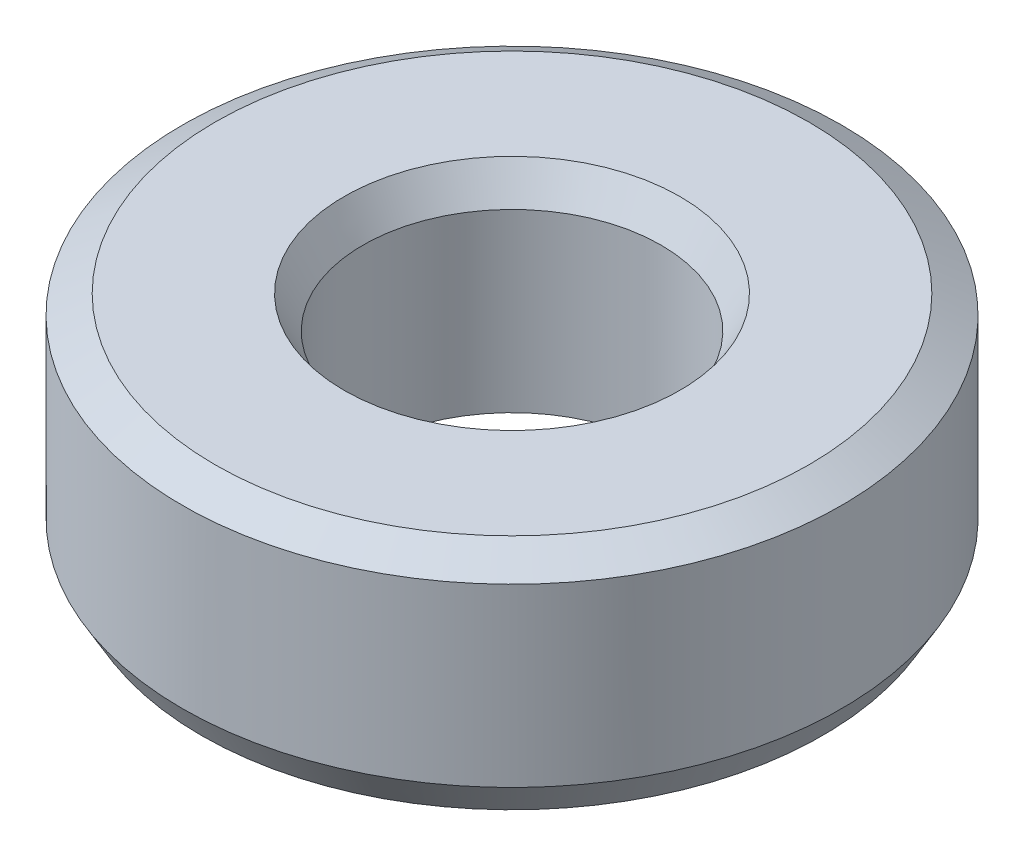
from build123d import *
from OCP.BRepFilletAPI import BRepFilletAPI_MakeChamfer

# Parameters (mm, degrees)
SKETCH1_R           = 45
BOSS_EXTRUDE1_DEPTH = 31.06856859
SKETCH2_R           = 20.356539013
CUT_EXTRUDE1_DEPTH  = 71.818471843
CHAMFER1_SIZE       = 2.574621667
CHAMFER1_SIZE2      = 4.459375538


with BuildPart() as part:
    # Sketch1 → Boss-Extrude1 (new body)
    with BuildSketch(Plane(origin=(0, 0, 0), x_dir=(1, 0, 0), z_dir=(0, 1, 0))):
        Circle(SKETCH1_R)
    extrude(amount=BOSS_EXTRUDE1_DEPTH)

    # Sketch2 → Cut-Extrude1 (cut, through all)
    with BuildSketch(Plane(origin=(0, 0, 0), x_dir=(1, 0, 0), z_dir=(0, 1, 0))):
        Circle(SKETCH2_R)
    extrude(amount=CUT_EXTRUDE1_DEPTH, mode=Mode.SUBTRACT)

    # Chamfer1: one chamfer whose edges measure the first distance from different faces: ONE call of the kernel's chamfer builder (chamfer() names one face for all edges)
    chamfer1_edges_1 = [part.edges().sort_by_distance(p)[0] for p in [
        (-20.356539013, 31.06856859, 0),
    ]]
    chamfer1_side_1 = [part.faces().sort_by_distance(p)[0] for p in [
        (-43.727207794, 31.06856859, 0),
    ]]
    chamfer1_edges_2 = [part.edges().sort_by_distance(p)[0] for p in [
        (-20.356539013, 0, 0),
    ]]
    chamfer1_side_2 = [part.faces().sort_by_distance(p)[0] for p in [
        (-20.356539013, 15.534284295, 0),
    ]]
    chamfer1_edges_3 = [part.edges().sort_by_distance(p)[0] for p in [
        (-45, 0, 0),
    ]]
    chamfer1_side_3 = [part.faces().sort_by_distance(p)[0] for p in [
        (-43.727207794, 0, 0),
    ]]
    chamfer1_edges_4 = [part.edges().sort_by_distance(p)[0] for p in [
        (-45, 31.06856859, 0),
    ]]
    chamfer1_side_4 = [part.faces().sort_by_distance(p)[0] for p in [
        (-45, 15.534284295, 0),
    ]]
    chamfer1 = BRepFilletAPI_MakeChamfer(part.part.solid().wrapped)
    for e in chamfer1_edges_1:
        chamfer1.Add(CHAMFER1_SIZE, CHAMFER1_SIZE2, e.wrapped, chamfer1_side_1[0].wrapped)  # the first distance lies on this face
    for e in chamfer1_edges_2:
        chamfer1.Add(CHAMFER1_SIZE, CHAMFER1_SIZE2, e.wrapped, chamfer1_side_2[0].wrapped)  # the first distance lies on this face
    for e in chamfer1_edges_3:
        chamfer1.Add(CHAMFER1_SIZE, CHAMFER1_SIZE2, e.wrapped, chamfer1_side_3[0].wrapped)  # the first distance lies on this face
    for e in chamfer1_edges_4:
        chamfer1.Add(CHAMFER1_SIZE, CHAMFER1_SIZE2, e.wrapped, chamfer1_side_4[0].wrapped)  # the first distance lies on this face
    add(Compound.cast(chamfer1.Shape()), mode=Mode.REPLACE)


solid = part.part
